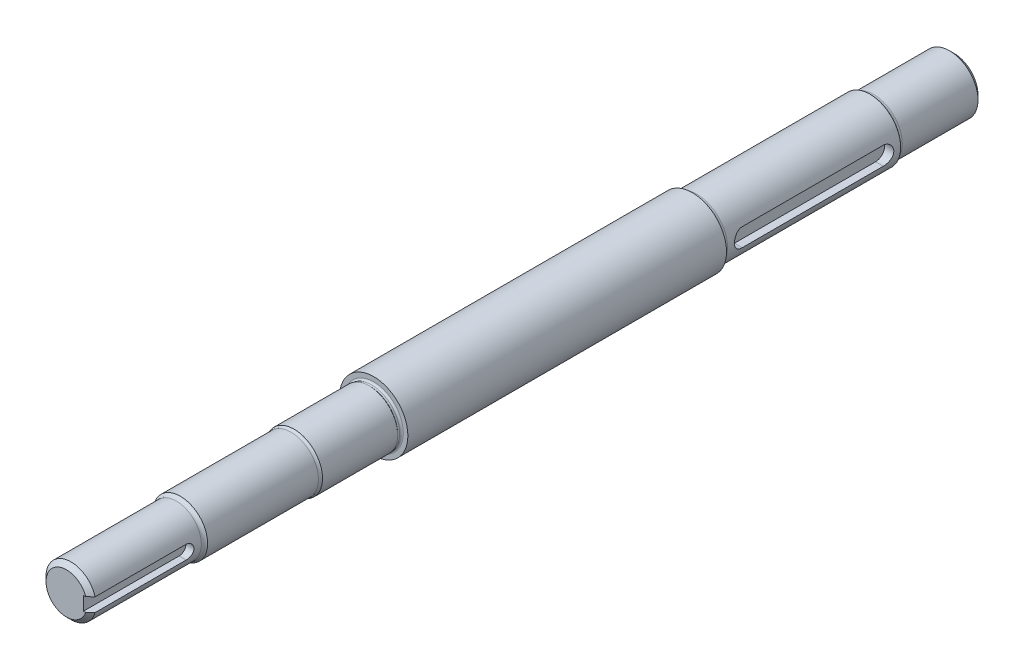
from build123d import *

# Parameters (mm, degrees)
FILLET_1_R          = 2
CHAMFER_1_SIZE      = 2
CUT_EXTRUDE_1_DEPTH = 17
CUT_EXTRUDE_2_DEPTH = 51


with BuildPart() as part:
    # 草图1 → 旋转1 (revolve)
    with BuildSketch(Plane(origin=(0, 0, 0), x_dir=(0, 0, -1), z_dir=(1, 0, 0)), mode=Mode.PRIVATE) as revolve_1_sk:
        with BuildLine():
            Line((-275, 0), (-275, 11))
            Line((-275, 11), (-225, 11))
            Line((-225, 11), (-225, 12))
            Line((-225, 12), (-175, 12))
            Line((-175, 12), (-175, 12.5))
            Line((-175, 12.5), (-142, 12.5))
            Line((-142, 12.5), (-141.7, 12.2))
            Line((-141.7, 12.2), (-140.8, 12.2))
            ThreePointArc((-140.8, 12.2), (-140.234314575, 12.434314575), (-140, 13))
            Line((-140, 13), (-140, 15))
            Line((-140, 15), (0, 15))
            Line((0, 15), (0, 13.5))
            Line((0, 13.5), (78, 13.5))
            Line((78, 13.5), (78, 12.5))
            Line((78, 12.5), (115, 12.5))
            Line((115, 12.5), (115, 0))
            Line((115, 0), (-275, 0))
        make_face()
    revolve(revolve_1_sk.sketch.rotate(Axis((0, 0, 55.025776128), (0, 0, -1)), 90), axis=Axis((0, 0, 55.025776128), (0, 0, -1)))

    # 圆角1
    # the kernel refuses this fillet: 2 mm, written as the material it adds along each edge
    with BuildSketch(Plane(origin=(0, 0, -78), x_dir=(1, 0, 0), z_dir=(0, 1, 0))) as fillet_1_piece_1:
        with BuildLine():
            CenterArc((14.5, 1.732050808), FILLET_1_R, 180, 60)
            Line((12.5, 1.732050808), (12.46, 1.732050808))
            Line((12.46, 1.732050808), (12.46, 0))
            Line((12.46, 0), (12.5, -0.04))
            ThreePointArc((12.5, -0.04), (13, -0.04), (13.48, -0.034641016))
            Line((13.48, -0.034641016), (13.5, 0))
        make_face()
    revolve(axis=Axis((0, 0, -78), (0, 0, -1)))
    with BuildSketch(Plane(origin=(0, 0, 0), x_dir=(1, 0, 0), z_dir=(0, 1, 0))) as fillet_1_piece_2:
        with BuildLine():
            CenterArc((15.5, 1.936491673), FILLET_1_R, 180, 75.522487814)
            Line((13.5, 1.936491673), (13.46, 1.936491673))
            Line((13.46, 1.936491673), (13.46, 0))
            Line((13.46, 0), (13.5, -0.04))
            ThreePointArc((13.5, -0.04), (14.25, -0.04), (14.99, -0.038729833))
            Line((14.99, -0.038729833), (15, 0))
        make_face()
    revolve(axis=Axis((0, 0, 0), (0, 0, -1)))
    with BuildSketch(Plane(origin=(0, 0, 175), x_dir=(1, 0, 0), z_dir=(0, 1, 0))) as fillet_1_piece_3:
        with BuildLine():
            CenterArc((14, -1.322875656), FILLET_1_R, 138.590377891, 41.409622109)
            Line((12.5, 0), (12.47, 0.026457513))
            ThreePointArc((12.47, 0.026457513), (12.25, 0.04), (12, 0.04))
            Line((12, 0.04), (11.96, 0))
            Line((11.96, 0), (11.96, -1.322875656))
            Line((11.96, -1.322875656), (12, -1.322875656))
        make_face()
    revolve(axis=Axis((0, 0, 175), (0, 0, -1)))
    with BuildSketch(Plane(origin=(0, 0, 225), x_dir=(1, 0, 0), z_dir=(0, 1, 0))) as fillet_1_piece_4:
        with BuildLine():
            CenterArc((13, -1.732050808), FILLET_1_R, 120, 60)
            Line((12, 0), (11.98, 0.034641016))
            ThreePointArc((11.98, 0.034641016), (11.5, 0.04), (11, 0.04))
            Line((11, 0.04), (10.96, 0))
            Line((10.96, 0), (10.96, -1.732050808))
            Line((10.96, -1.732050808), (11, -1.732050808))
        make_face()
    revolve(axis=Axis((0, 0, 225), (0, 0, -1)))

    # 倒角1
    chamfer_1_edges = [part.edges().sort_by_distance(p)[0] for p in [
        (-12.5, 0, -115),
        (-11, 0, 275),
    ]]
    chamfer(chamfer_1_edges, length=CHAMFER_1_SIZE)

    # 草图2 → 切除-拉伸1 (cut)
    with BuildSketch(Plane(origin=(7.5, 0, 0), x_dir=(0, 0, -1), z_dir=(1, 0, 0))):
        with BuildLine():
            Line((-275, 3), (-233, 3))
            ThreePointArc((-233, 3), (-230, 0), (-233, -3))
            Line((-233, -3), (-275, -3))
            Line((-275, -3), (-275, 3))
        make_face()
    extrude(amount=CUT_EXTRUDE_1_DEPTH, mode=Mode.SUBTRACT)

    # 草图3 → 切除-拉伸2 (cut)
    with BuildSketch(Plane(origin=(9.5, 0, 0), x_dir=(0, 0, -1), z_dir=(1, 0, 0))):
        with BuildLine():
            Line((9, 4), (71, 4))
            ThreePointArc((71, 4), (75, 0), (71, -4))
            Line((71, -4), (9, -4))
            ThreePointArc((9, -4), (5, 0), (9, 4))
        make_face()
    extrude(amount=CUT_EXTRUDE_2_DEPTH, mode=Mode.SUBTRACT)


solid = part.part
